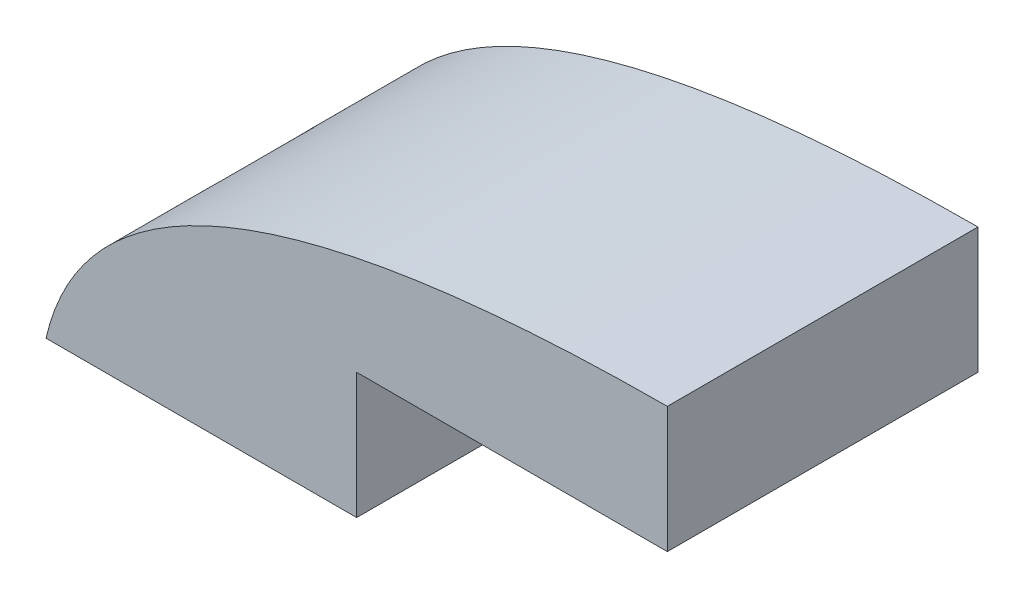
from build123d import *

# Parameters (mm, degrees)
SKETCH2_W           = 7.9
SKETCH2_H           = 7.9
BOSS_EXTRUDE1_DEPTH = 3.2
SKETCH3_W           = 7.9
SKETCH3_H           = 7.9
BOSS_EXTRUDE2_DEPTH = 3.2
SKETCH7_W           = 7.9
SKETCH7_H           = 3.2
BOSS_EXTRUDE5_DEPTH = 7.2
CUT_EXTRUDE2_DEPTH  = 8.2


with BuildPart() as part:
    # Sketch2 → Boss-Extrude1 (new body)
    with BuildSketch(Plane(origin=(0, 0, 0), x_dir=(1, 0, 0), z_dir=(0, 1, 0))):
        with Locations((3.95, 3.95)):
            Rectangle(SKETCH2_W, SKETCH2_H)
    extrude(amount=BOSS_EXTRUDE1_DEPTH)



with BuildPart() as body_2:
    # Sketch3 → Boss-Extrude2 (new body)
    with BuildSketch(Plane(origin=(0, 3.2, 0), x_dir=(1, 0, 0), z_dir=(0, 1, 0))):
        with Locations((11.85, 3.95)):
            Rectangle(SKETCH3_W, SKETCH3_H)
    extrude(amount=BOSS_EXTRUDE2_DEPTH)


with BuildPart() as part_1:
    add(part.part)

    add(body_2.part)  # Boss-Extrude5 merges body 2
    # Sketch7 → Boss-Extrude5 (add)
    with BuildSketch(Plane.ZY.offset(-7.9)):
        with Locations((-3.95, 4.8)):
            Rectangle(SKETCH7_W, SKETCH7_H)
    extrude(amount=BOSS_EXTRUDE5_DEPTH)

    # Sketch4 → Cut-Extrude2 (cut)
    with BuildSketch(Plane(origin=(0, 0, -7.9), x_dir=(-1, 0, 0), z_dir=(0, 0, -1))):
        with BuildLine():
            Line((-15.8, 6.4), (0, 6.4))
            Line((0, 6.4), (0, 0))
            add(Edge.make_bspline(
                [(-15.8, 6.4), (-1.472388227, 6.357101462), (0, 0)],
                knots=[0, 0, 0, 1, 1, 1], degree=2))
        make_face()
    extrude(amount=-CUT_EXTRUDE2_DEPTH, mode=Mode.SUBTRACT)


solid = part_1.part
